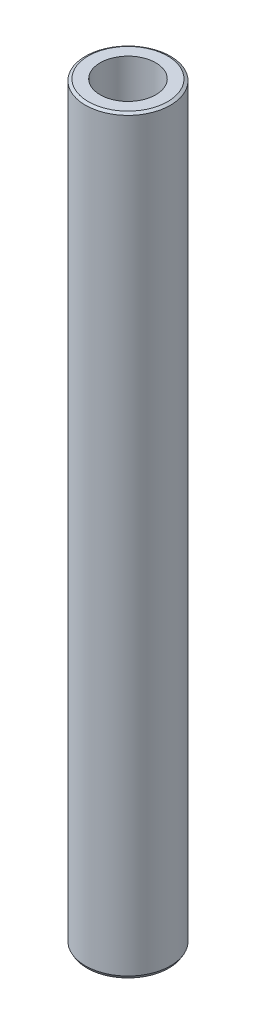
from build123d import *
from OCP.BRepFilletAPI import BRepFilletAPI_MakeChamfer

# Parameters (mm, degrees)
SKETCH1_R           = 15
BOSS_EXTRUDE1_DEPTH = 264.663394843
SKETCH2_R           = 9.810323504
CUT_EXTRUDE1_DEPTH  = 266.512170286
CHAMFER1_SIZE       = 0.582063919
CHAMFER1_SIZE2      = 1.00816428


with BuildPart() as part:
    # Sketch1 → Boss-Extrude1 (new body)
    with BuildSketch(Plane(origin=(0, 0, 0), x_dir=(1, 0, 0), z_dir=(0, 1, 0))):
        Circle(SKETCH1_R)
    extrude(amount=BOSS_EXTRUDE1_DEPTH)

    # Sketch2 → Cut-Extrude1 (cut, through all)
    with BuildSketch(Plane(origin=(0, 0, 0), x_dir=(1, 0, 0), z_dir=(0, 1, 0))):
        Circle(SKETCH2_R)
    extrude(amount=CUT_EXTRUDE1_DEPTH, mode=Mode.SUBTRACT)

    # Chamfer1: one chamfer whose edges measure the first distance from different faces: ONE call of the kernel's chamfer builder (chamfer() names one face for all edges)
    chamfer1_edges_1 = [part.edges().sort_by_distance(p)[0] for p in [
        (-15, 264.663394843, 0),
    ]]
    chamfer1_side_1 = [part.faces().sort_by_distance(p)[0] for p in [
        (-15, 132.331697422, 0),
    ]]
    chamfer1_edges_2 = [part.edges().sort_by_distance(p)[0] for p in [
        (-15, 0, 0),
    ]]
    chamfer1_side_2 = [part.faces().sort_by_distance(p)[0] for p in [
        (-14.575735931, 0, 0),
    ]]
    chamfer1 = BRepFilletAPI_MakeChamfer(part.part.solid().wrapped)
    for e in chamfer1_edges_1:
        chamfer1.Add(CHAMFER1_SIZE, CHAMFER1_SIZE2, e.wrapped, chamfer1_side_1[0].wrapped)  # the first distance lies on this face
    for e in chamfer1_edges_2:
        chamfer1.Add(CHAMFER1_SIZE, CHAMFER1_SIZE2, e.wrapped, chamfer1_side_2[0].wrapped)  # the first distance lies on this face
    add(Compound.cast(chamfer1.Shape()), mode=Mode.REPLACE)


solid = part.part
